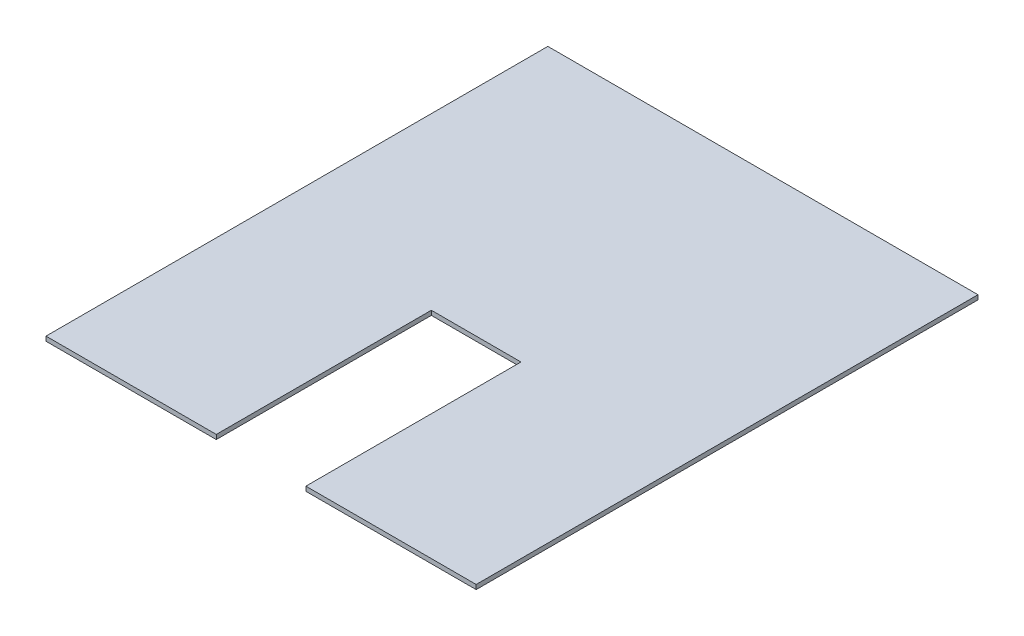
from build123d import *

# Parameters (mm, degrees)
SKETCH1_W           = 304.8
SKETCH1_H           = 355.6
BOSS_EXTRUDE1_DEPTH = 3.175
SKETCH2_W           = 63.5
SKETCH2_H           = 152.4
CUT_EXTRUDE1_DEPTH  = 3.175


with BuildPart() as part:
    # Sketch1 → Boss-Extrude1 (new body)
    with BuildSketch(Plane(origin=(0, 0, 0), x_dir=(1, 0, 0), z_dir=(0, 1, 0))):
        Rectangle(SKETCH1_W, SKETCH1_H)
    extrude(amount=BOSS_EXTRUDE1_DEPTH)

    # Sketch2 → Cut-Extrude1 (cut)
    with BuildSketch(Plane(origin=(0, 3.175, 0), x_dir=(1, 0, 0), z_dir=(0, 1, 0))):
        with Locations((0, -101.6)):
            Rectangle(SKETCH2_W, SKETCH2_H)
    extrude(amount=-CUT_EXTRUDE1_DEPTH, mode=Mode.SUBTRACT)


solid = part.part
